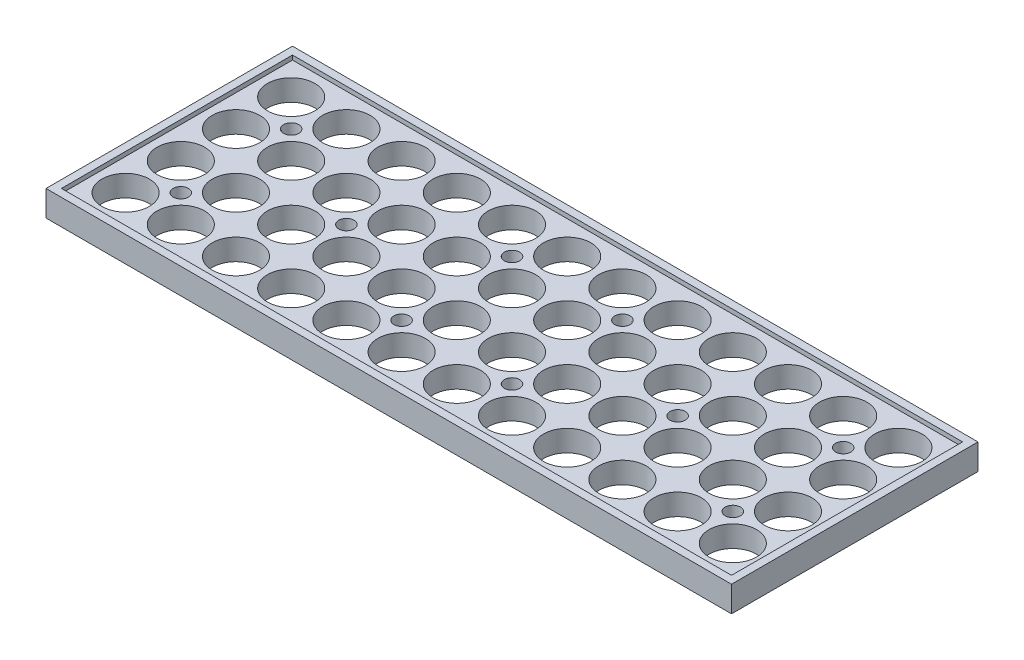
from build123d import *

# Parameters (mm, degrees)
SKETCH1_W                  = 267
SKETCH1_H                  = 96
BOSS_EXTRUDE1_DEPTH        = 10
SKETCH5_W                  = 261
SKETCH5_H                  = 90
CUT_EXTRUDE2_DEPTH         = 1.7
SKETCH2_R                  = 9.25
CUT_EXTRUDE1_DEPTH         = 10
LPATTERN1_COUNT            = 4
LPATTERN1_PITCH            = 21.5
LPATTERN1_COUNT_DIR2       = 12
LPATTERN1_PITCH_DIR2       = 21.5
ADVANCEDHOLE2_OUTLINE_R    = 2.640558065
ADVANCEDHOLE2_DEPTH        = 7.996
ADVANCEDHOLE2_DRAFT        = -2.3593
ADVANCEDHOLE2_2_OUTLINE_R  = 2.640558065
ADVANCEDHOLE2_2_DEPTH      = 7.996
ADVANCEDHOLE2_2_DRAFT      = -2.3593
ADVANCEDHOLE2_3_OUTLINE_R  = 2.640558065
ADVANCEDHOLE2_3_DEPTH      = 7.996
ADVANCEDHOLE2_3_DRAFT      = -2.3593
ADVANCEDHOLE2_4_OUTLINE_R  = 2.640558065
ADVANCEDHOLE2_4_DEPTH      = 7.996
ADVANCEDHOLE2_4_DRAFT      = -2.3593
ADVANCEDHOLE2_5_OUTLINE_R  = 2.640558065
ADVANCEDHOLE2_5_DEPTH      = 7.996
ADVANCEDHOLE2_5_DRAFT      = -2.3593
ADVANCEDHOLE2_6_OUTLINE_R  = 2.640558065
ADVANCEDHOLE2_6_DEPTH      = 7.996
ADVANCEDHOLE2_6_DRAFT      = -2.3593
ADVANCEDHOLE2_7_OUTLINE_R  = 2.640558065
ADVANCEDHOLE2_7_DEPTH      = 7.996
ADVANCEDHOLE2_7_DRAFT      = -2.3593
ADVANCEDHOLE2_8_OUTLINE_R  = 2.640558065
ADVANCEDHOLE2_8_DEPTH      = 7.996
ADVANCEDHOLE2_8_DRAFT      = -2.3593
ADVANCEDHOLE2_9_OUTLINE_R  = 2.640558065
ADVANCEDHOLE2_9_DEPTH      = 7.996
ADVANCEDHOLE2_9_DRAFT      = -2.3593
ADVANCEDHOLE2_10_OUTLINE_R = 2.640558065
ADVANCEDHOLE2_10_DEPTH     = 7.996
ADVANCEDHOLE2_10_DRAFT     = -2.3593


# Read off the part's stored shape, not the designer's step: AdvancedHole2
with BuildPart() as part:
    # Sketch1 → Boss-Extrude1 (new body)
    with BuildSketch(Plane(origin=(0, 0, 0), x_dir=(1, 0, 0), z_dir=(0, 1, 0))):
        with Locations((133.5, 48)):
            Rectangle(SKETCH1_W, SKETCH1_H)
    extrude(amount=BOSS_EXTRUDE1_DEPTH)

    # Sketch5 → Cut-Extrude2 (cut)
    with BuildSketch(Plane(origin=(0, 10, 0), x_dir=(1, 0, 0), z_dir=(0, 1, 0))):
        with Locations((133.5, 48)):
            Rectangle(SKETCH5_W, SKETCH5_H)
    extrude(amount=-CUT_EXTRUDE2_DEPTH, mode=Mode.SUBTRACT)

    # Sketch2 → Cut-Extrude1 (cut)
    with BuildSketch(Plane(origin=(0, 10, 0), x_dir=(1, 0, 0), z_dir=(0, 1, 0))):
        with Locations(Location((15.25, 15.75, 0), (0, 0, 270))):
            Circle(SKETCH2_R)
    cut_extrude1 = extrude(amount=-CUT_EXTRUDE1_DEPTH, mode=Mode.SUBTRACT)

    # LPattern1: Cut-Extrude1 4 × 12
    with Locations(*[(j * LPATTERN1_PITCH_DIR2, 0, -i * LPATTERN1_PITCH) for i in range(LPATTERN1_COUNT) for j in range(LPATTERN1_COUNT_DIR2) if (i, j) != (0, 0)]):
        add(cut_extrude1, mode=Mode.SUBTRACT)


with BuildPart() as advancedhole2_tool:
    # AdvancedHole2 outline → AdvancedHole2 (with draft: the straight prism first)
    with BuildSketch(Plane(origin=(0, 0.304, 0), x_dir=(1, 0, 0), z_dir=(0, 1, 0))):
        with Locations((155, 69.5)):
            Circle(ADVANCEDHOLE2_OUTLINE_R)
    extrude(amount=ADVANCEDHOLE2_DEPTH)
    # AdvancedHole2: the draft: its side faces are tilted about the plane it starts from
    advancedhole2_sides = [advancedhole2_tool.faces().sort_by_distance(p)[0] for p in [
        (152.359441935, 4.302, -69.5),
    ]]
    draft(advancedhole2_sides, Plane(origin=(0, 0.304, 0), x_dir=(1, 0, 0), z_dir=(0, 1, 0)), ADVANCEDHOLE2_DRAFT)


with BuildPart() as part_1:
    add(part.part)

    # AdvancedHole2: cut by advancedhole2_tool
    add(advancedhole2_tool.part, mode=Mode.SUBTRACT)


with BuildPart() as advancedhole2_2_tool:
    # AdvancedHole2 2 outline → AdvancedHole2 2 (with draft: the straight prism first)
    with BuildSketch(Plane(origin=(0, 0.304, 0), x_dir=(1, 0, 0), z_dir=(0, 1, 0))):
        with Locations((155, 26.5)):
            Circle(ADVANCEDHOLE2_2_OUTLINE_R)
    extrude(amount=ADVANCEDHOLE2_2_DEPTH)
    # AdvancedHole2 2: the draft: its side faces are tilted about the plane it starts from
    advancedhole2_2_sides = [advancedhole2_2_tool.faces().sort_by_distance(p)[0] for p in [
        (152.359441935, 4.302, -26.5),
    ]]
    draft(advancedhole2_2_sides, Plane(origin=(0, 0.304, 0), x_dir=(1, 0, 0), z_dir=(0, 1, 0)), ADVANCEDHOLE2_2_DRAFT)


with BuildPart() as part_2:
    add(part_1.part)

    # AdvancedHole2 2: cut by advancedhole2_2_tool
    add(advancedhole2_2_tool.part, mode=Mode.SUBTRACT)


with BuildPart() as advancedhole2_3_tool:
    # AdvancedHole2 3 outline → AdvancedHole2 3 (with draft: the straight prism first)
    with BuildSketch(Plane(origin=(0, 0.304, 0), x_dir=(1, 0, 0), z_dir=(0, 1, 0))):
        with Locations((112, 26.5)):
            Circle(ADVANCEDHOLE2_3_OUTLINE_R)
    extrude(amount=ADVANCEDHOLE2_3_DEPTH)
    # AdvancedHole2 3: the draft: its side faces are tilted about the plane it starts from
    advancedhole2_3_sides = [advancedhole2_3_tool.faces().sort_by_distance(p)[0] for p in [
        (109.359441935, 4.302, -26.5),
    ]]
    draft(advancedhole2_3_sides, Plane(origin=(0, 0.304, 0), x_dir=(1, 0, 0), z_dir=(0, 1, 0)), ADVANCEDHOLE2_3_DRAFT)


with BuildPart() as part_3:
    add(part_2.part)

    # AdvancedHole2 3: cut by advancedhole2_3_tool
    add(advancedhole2_3_tool.part, mode=Mode.SUBTRACT)


with BuildPart() as advancedhole2_4_tool:
    # AdvancedHole2 4 outline → AdvancedHole2 4 (with draft: the straight prism first)
    with BuildSketch(Plane(origin=(0, 0.304, 0), x_dir=(1, 0, 0), z_dir=(0, 1, 0))):
        with Locations((112, 69.5)):
            Circle(ADVANCEDHOLE2_4_OUTLINE_R)
    extrude(amount=ADVANCEDHOLE2_4_DEPTH)
    # AdvancedHole2 4: the draft: its side faces are tilted about the plane it starts from
    advancedhole2_4_sides = [advancedhole2_4_tool.faces().sort_by_distance(p)[0] for p in [
        (109.359441935, 4.302, -69.5),
    ]]
    draft(advancedhole2_4_sides, Plane(origin=(0, 0.304, 0), x_dir=(1, 0, 0), z_dir=(0, 1, 0)), ADVANCEDHOLE2_4_DRAFT)


with BuildPart() as part_4:
    add(part_3.part)

    # AdvancedHole2 4: cut by advancedhole2_4_tool
    add(advancedhole2_4_tool.part, mode=Mode.SUBTRACT)


with BuildPart() as advancedhole2_5_tool:
    # AdvancedHole2 5 outline → AdvancedHole2 5 (with draft: the straight prism first)
    with BuildSketch(Plane(origin=(0, 0.304, 0), x_dir=(1, 0, 0), z_dir=(0, 1, 0))):
        with Locations((198, 48)):
            Circle(ADVANCEDHOLE2_5_OUTLINE_R)
    extrude(amount=ADVANCEDHOLE2_5_DEPTH)
    # AdvancedHole2 5: the draft: its side faces are tilted about the plane it starts from
    advancedhole2_5_sides = [advancedhole2_5_tool.faces().sort_by_distance(p)[0] for p in [
        (195.359441935, 4.302, -48),
    ]]
    draft(advancedhole2_5_sides, Plane(origin=(0, 0.304, 0), x_dir=(1, 0, 0), z_dir=(0, 1, 0)), ADVANCEDHOLE2_5_DRAFT)


with BuildPart() as part_5:
    add(part_4.part)

    # AdvancedHole2 5: cut by advancedhole2_5_tool
    add(advancedhole2_5_tool.part, mode=Mode.SUBTRACT)


with BuildPart() as advancedhole2_6_tool:
    # AdvancedHole2 6 outline → AdvancedHole2 6 (with draft: the straight prism first)
    with BuildSketch(Plane(origin=(0, 0.304, 0), x_dir=(1, 0, 0), z_dir=(0, 1, 0))):
        with Locations((69, 48)):
            Circle(ADVANCEDHOLE2_6_OUTLINE_R)
    extrude(amount=ADVANCEDHOLE2_6_DEPTH)
    # AdvancedHole2 6: the draft: its side faces are tilted about the plane it starts from
    advancedhole2_6_sides = [advancedhole2_6_tool.faces().sort_by_distance(p)[0] for p in [
        (66.359441935, 4.302, -48),
    ]]
    draft(advancedhole2_6_sides, Plane(origin=(0, 0.304, 0), x_dir=(1, 0, 0), z_dir=(0, 1, 0)), ADVANCEDHOLE2_6_DRAFT)


with BuildPart() as part_6:
    add(part_5.part)

    # AdvancedHole2 6: cut by advancedhole2_6_tool
    add(advancedhole2_6_tool.part, mode=Mode.SUBTRACT)


with BuildPart() as advancedhole2_7_tool:
    # AdvancedHole2 7 outline → AdvancedHole2 7 (with draft: the straight prism first)
    with BuildSketch(Plane(origin=(0, 0.304, 0), x_dir=(1, 0, 0), z_dir=(0, 1, 0))):
        with Locations((26, 26.5)):
            Circle(ADVANCEDHOLE2_7_OUTLINE_R)
    extrude(amount=ADVANCEDHOLE2_7_DEPTH)
    # AdvancedHole2 7: the draft: its side faces are tilted about the plane it starts from
    advancedhole2_7_sides = [advancedhole2_7_tool.faces().sort_by_distance(p)[0] for p in [
        (23.359441935, 4.302, -26.5),
    ]]
    draft(advancedhole2_7_sides, Plane(origin=(0, 0.304, 0), x_dir=(1, 0, 0), z_dir=(0, 1, 0)), ADVANCEDHOLE2_7_DRAFT)


with BuildPart() as part_7:
    add(part_6.part)

    # AdvancedHole2 7: cut by advancedhole2_7_tool
    add(advancedhole2_7_tool.part, mode=Mode.SUBTRACT)


with BuildPart() as advancedhole2_8_tool:
    # AdvancedHole2 8 outline → AdvancedHole2 8 (with draft: the straight prism first)
    with BuildSketch(Plane(origin=(0, 0.304, 0), x_dir=(1, 0, 0), z_dir=(0, 1, 0))):
        with Locations((241, 26.5)):
            Circle(ADVANCEDHOLE2_8_OUTLINE_R)
    extrude(amount=ADVANCEDHOLE2_8_DEPTH)
    # AdvancedHole2 8: the draft: its side faces are tilted about the plane it starts from
    advancedhole2_8_sides = [advancedhole2_8_tool.faces().sort_by_distance(p)[0] for p in [
        (238.359441935, 4.302, -26.5),
    ]]
    draft(advancedhole2_8_sides, Plane(origin=(0, 0.304, 0), x_dir=(1, 0, 0), z_dir=(0, 1, 0)), ADVANCEDHOLE2_8_DRAFT)


with BuildPart() as part_8:
    add(part_7.part)

    # AdvancedHole2 8: cut by advancedhole2_8_tool
    add(advancedhole2_8_tool.part, mode=Mode.SUBTRACT)


with BuildPart() as advancedhole2_9_tool:
    # AdvancedHole2 9 outline → AdvancedHole2 9 (with draft: the straight prism first)
    with BuildSketch(Plane(origin=(0, 0.304, 0), x_dir=(1, 0, 0), z_dir=(0, 1, 0))):
        with Locations((241, 69.5)):
            Circle(ADVANCEDHOLE2_9_OUTLINE_R)
    extrude(amount=ADVANCEDHOLE2_9_DEPTH)
    # AdvancedHole2 9: the draft: its side faces are tilted about the plane it starts from
    advancedhole2_9_sides = [advancedhole2_9_tool.faces().sort_by_distance(p)[0] for p in [
        (238.359441935, 4.302, -69.5),
    ]]
    draft(advancedhole2_9_sides, Plane(origin=(0, 0.304, 0), x_dir=(1, 0, 0), z_dir=(0, 1, 0)), ADVANCEDHOLE2_9_DRAFT)


with BuildPart() as part_9:
    add(part_8.part)

    # AdvancedHole2 9: cut by advancedhole2_9_tool
    add(advancedhole2_9_tool.part, mode=Mode.SUBTRACT)


with BuildPart() as advancedhole2_10_tool:
    # AdvancedHole2 10 outline → AdvancedHole2 10 (with draft: the straight prism first)
    with BuildSketch(Plane(origin=(0, 0.304, 0), x_dir=(1, 0, 0), z_dir=(0, 1, 0))):
        with Locations((26, 69.5)):
            Circle(ADVANCEDHOLE2_10_OUTLINE_R)
    extrude(amount=ADVANCEDHOLE2_10_DEPTH)
    # AdvancedHole2 10: the draft: its side faces are tilted about the plane it starts from
    advancedhole2_10_sides = [advancedhole2_10_tool.faces().sort_by_distance(p)[0] for p in [
        (23.359441935, 4.302, -69.5),
    ]]
    draft(advancedhole2_10_sides, Plane(origin=(0, 0.304, 0), x_dir=(1, 0, 0), z_dir=(0, 1, 0)), ADVANCEDHOLE2_10_DRAFT)


with BuildPart() as part_10:
    add(part_9.part)

    # AdvancedHole2 10: cut by advancedhole2_10_tool
    add(advancedhole2_10_tool.part, mode=Mode.SUBTRACT)


solid = part_10.part
